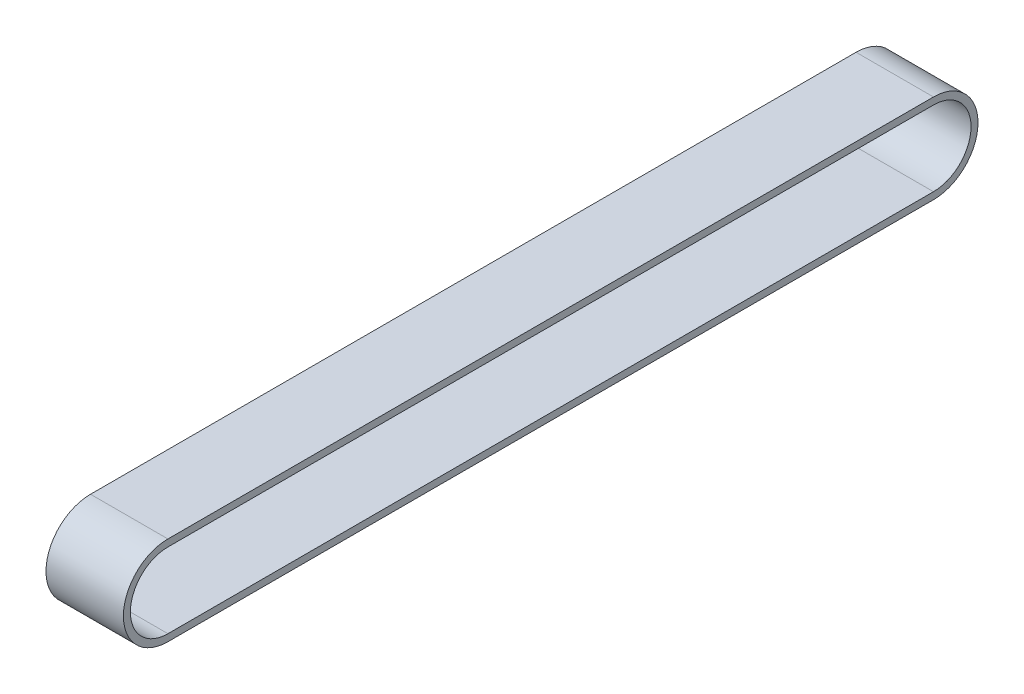
from build123d import *

# Parameters (mm, degrees)
BOSS_EXTRUDE1_DEPTH = 12.7


with BuildPart() as part:
    # Sketch1 → Boss-Extrude1 (new, symmetric)
    with BuildSketch(Plane(origin=(0, 0, 0), x_dir=(0, 0, -1), z_dir=(1, 0, 0))):
        with BuildLine():
            Line((-125.5824006, 14.605), (125.5824006, 14.605))
            ThreePointArc((125.5824006, 14.605), (140.1874006, 0), (125.5824006, -14.605))
            Line((125.5824006, -14.605), (-125.5824006, -14.605))
            ThreePointArc((-125.5824006, -14.605), (-140.1874006, 0), (-125.5824006, 14.605))
        make_face()
        with BuildLine():
            Line((-125.5824006, 12.319), (125.5824006, 12.319))
            ThreePointArc((125.5824006, 12.319), (137.9014006, 0), (125.5824006, -12.319))
            Line((125.5824006, -12.319), (-125.5824006, -12.319))
            ThreePointArc((-125.5824006, -12.319), (-137.9014006, 0), (-125.5824006, 12.319))
        make_face(mode=Mode.SUBTRACT)
    extrude(amount=BOSS_EXTRUDE1_DEPTH, both=True)


solid = part.part
